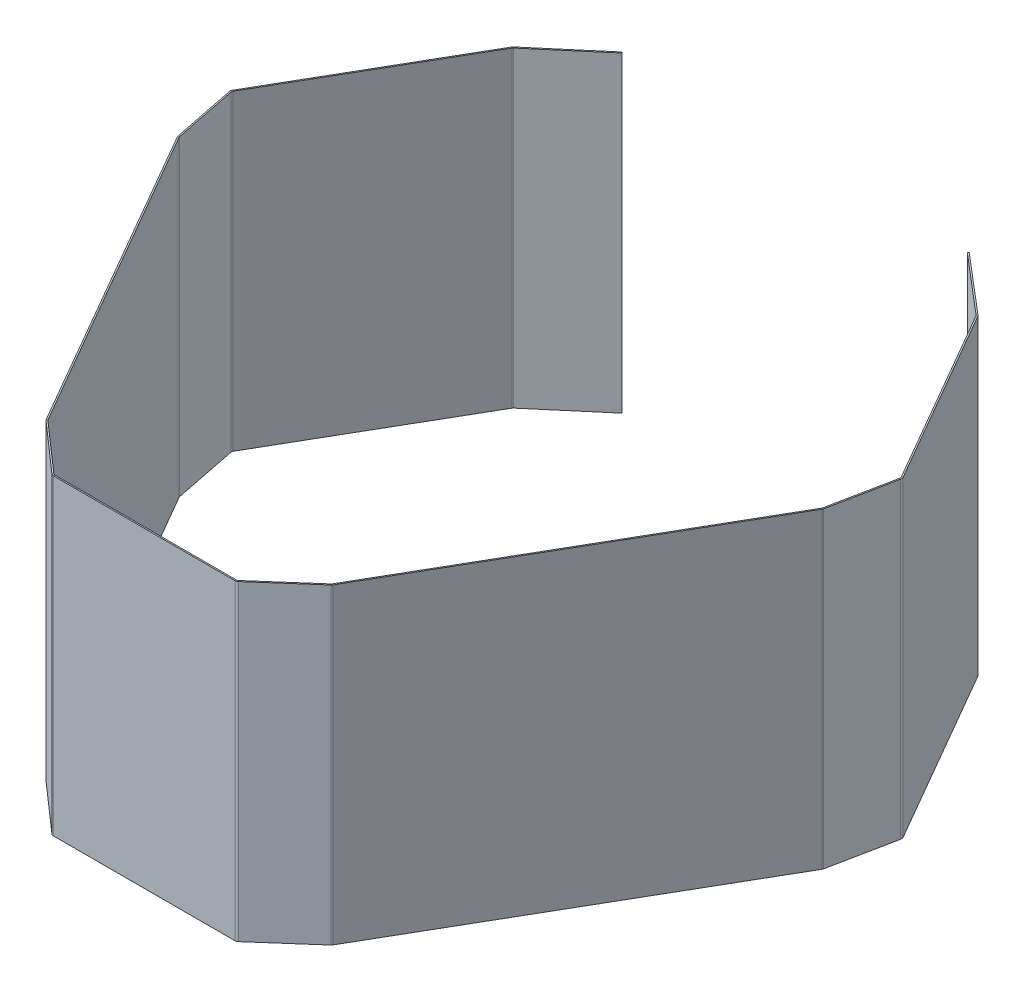
from build123d import *

# Parameters (mm, degrees)
SM_BASE_FLANGE_1_DEPTH = 233


# Sheet-metal steps are written as plain solids
with BuildPart() as part:
    # 草图1 → 基体-法兰1 (new body)
    with BuildSketch(Plane(origin=(0, 0, 0), x_dir=(1, 0, 0), z_dir=(0, 1, 0))):
        with BuildLine():
            Line((-129, 230), (-172.917182347, 192.646402715))
            ThreePointArc((-172.917182347, 192.646402715), (-173.157776183, 192.403386175), (-173.353453197, 192.122934861))
            Line((-173.353453197, 192.122934861), (-249.622758888, 60.020622347))
            ThreePointArc((-249.622758888, 60.020622347), (-249.864241735, 59.344913751), (-249.8516834, 58.627461063))
            Line((-249.8516834, 58.627461063), (-240.235572229, 10.665066397))
            ThreePointArc((-240.235572229, 10.665066397), (-240.145872891, 10.352305448), (-240.006647716, 10.058227681))
            Line((-240.006647716, 10.058227681), (-106.206165205, -221.691006107))
            ThreePointArc((-106.206165205, -221.691006107), (-106.021098975, -221.958617528), (-105.795089717, -222.192679908))
            Line((-105.795089717, -222.192679908), (-69.066493095, -254.501673801))
            ThreePointArc((-69.066493095, -254.501673801), (-68.451440008, -254.871275982), (-67.745517775, -255))
            Line((-67.745517775, -255), (67.745517775, -255))
            ThreePointArc((67.745517775, -255), (68.451440008, -254.871275982), (69.066493095, -254.501673801))
            Line((69.066493095, -254.501673801), (105.795089717, -222.192679908))
            ThreePointArc((105.795089717, -222.192679908), (106.021098975, -221.958617528), (106.206165205, -221.691006107))
            Line((106.206165205, -221.691006107), (240.006647716, 10.058227681))
            ThreePointArc((240.006647716, 10.058227681), (240.145872891, 10.352305448), (240.235572229, 10.665066397))
            Line((240.235572229, 10.665066397), (249.8516834, 58.627461063))
            ThreePointArc((249.8516834, 58.627461063), (249.864241735, 59.344913751), (249.622758888, 60.020622347))
            Line((249.622758888, 60.020622347), (173.353453197, 192.122934861))
            ThreePointArc((173.353453197, 192.122934861), (173.157776183, 192.403386175), (172.917182347, 192.646402715))
            Line((172.917182347, 192.646402715), (129, 230))
            Line((129, 230), (129.647889979, 230.761733927))
            Line((129.647889979, 230.761733927), (173.565072326, 193.408136642))
            ThreePointArc((173.565072326, 193.408136642), (173.92596308, 193.043611831), (174.219478601, 192.622934861))
            Line((174.219478601, 192.622934861), (250.488784291, 60.520622347))
            ThreePointArc((250.488784291, 60.520622347), (250.851008562, 59.507059453), (250.83217106, 58.430880421))
            Line((250.83217106, 58.430880421), (241.216059889, 10.468485755))
            ThreePointArc((241.216059889, 10.468485755), (241.081510882, 9.999344331), (240.87267312, 9.558227681))
            Line((240.87267312, 9.558227681), (107.072190608, -222.191006107))
            ThreePointArc((107.072190608, -222.191006107), (106.794591264, -222.592423239), (106.455577377, -222.943516809))
            Line((106.455577377, -222.943516809), (69.726980755, -255.252510702))
            ThreePointArc((69.726980755, -255.252510702), (68.804401125, -255.806913973), (67.745517775, -256))
            Line((67.745517775, -256), (-67.745517775, -256))
            ThreePointArc((-67.745517775, -256), (-68.804401125, -255.806913973), (-69.726980755, -255.252510702))
            Line((-69.726980755, -255.252510702), (-106.455577377, -222.943516809))
            ThreePointArc((-106.455577377, -222.943516809), (-106.794591264, -222.592423239), (-107.072190608, -222.191006107))
            Line((-107.072190608, -222.191006107), (-240.87267312, 9.558227681))
            ThreePointArc((-240.87267312, 9.558227681), (-241.081510882, 9.999344331), (-241.216059889, 10.468485754))
            Line((-241.216059889, 10.468485755), (-250.83217106, 58.430880421))
            ThreePointArc((-250.83217106, 58.430880421), (-250.851008562, 59.507059453), (-250.488784291, 60.520622347))
            Line((-250.488784291, 60.520622347), (-174.219478601, 192.622934861))
            ThreePointArc((-174.219478601, 192.622934861), (-173.92596308, 193.043611831), (-173.565072326, 193.408136642))
            Line((-173.565072326, 193.408136642), (-129.647889979, 230.761733927))
            Line((-129.647889979, 230.761733927), (-129, 230))
        make_face()
    extrude(amount=SM_BASE_FLANGE_1_DEPTH)


solid = part.part
